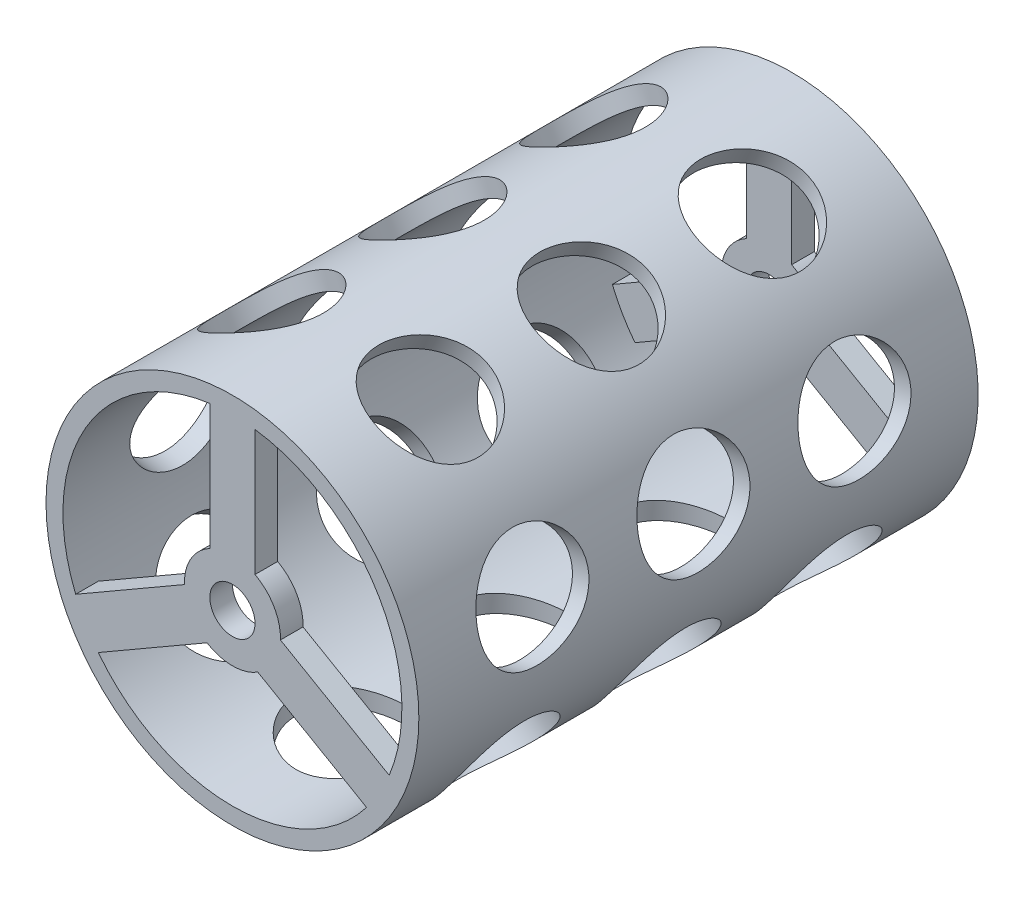
from build123d import *
from build123d.topology import SkipClean

# Parameters (mm, degrees)
IZIM1_R                     = 33
IZIM1_R_2                   = 30
Y_KSEKLIK_EKSTR_ZYON1_DEPTH = 95
Y_KSEKLIK_EKSTR_ZYON2_START = 4
IZIM2_R                     = 33
Y_KSEKLIK_EKSTR_ZYON2_DEPTH = 4
Y_KSEKLIK_EKSTR_ZYON3_START = -4
IZIM3_R                     = 33
Y_KSEKLIK_EKSTR_ZYON3_DEPTH = 4
KES_EKSTR_ZYON1_DEPTH       = 122
IZIM5_R                     = 4
KES_EKSTR_ZYON2_DEPTH       = 122
KES_EKSTR_ZYON3_START       = -75
IZIM6_R                     = 9.75
KES_EKSTR_ZYON3_DEPTH       = 81
DAIRESEL_KAPLAMA1_COUNT     = 7


with BuildPart() as part:
    # Çizim1 → Yükseklik-Ekstrüzyon1 (new body)
    with BuildSketch(Plane.XY):
        Circle(IZIM1_R)
        Circle(IZIM1_R_2, mode=Mode.SUBTRACT)
    extrude(amount=Y_KSEKLIK_EKSTR_ZYON1_DEPTH)

    # Çizim2 → Yükseklik-Ekstrüzyon2 (add)
    with BuildSketch(Plane(origin=(0, 0, 0), x_dir=(-1, 0, 0), z_dir=(0, 0, -1)).offset(Y_KSEKLIK_EKSTR_ZYON2_START)):
        Circle(IZIM2_R)
    extrude(amount=-Y_KSEKLIK_EKSTR_ZYON2_DEPTH)

    # Çizim3 → Yükseklik-Ekstrüzyon3 (add)
    with BuildSketch(Plane.XY.offset(95).offset(Y_KSEKLIK_EKSTR_ZYON3_START)):
        Circle(IZIM3_R)
    extrude(amount=Y_KSEKLIK_EKSTR_ZYON3_DEPTH)

    # Çizim4 → Kes-Ekstrüzyon1 (cut)
    with BuildSketch(Plane(origin=(0, 0, -4), x_dir=(-1, 0, 0), z_dir=(0, 0, -1))):
        with BuildLine():
            ThreePointArc((4, 7.5), (7.361215932, 4.25), (8.495190528, -0.285898385))
            Line((8.495190528, -0.285898385), (27.748786379, -11.401967132))
            ThreePointArc((27.748786379, -11.401967132), (25.980762114, 15), (4, 29.732137495))
            Line((4, 29.732137495), (4, 7.5))
        make_face()
        with BuildLine():
            Line((-4, 7.5), (-4, 29.732137495))
            ThreePointArc((-4, 29.732137495), (-25.980762114, 15), (-27.748786379, -11.401967132))
            Line((-27.748786379, -11.401967132), (-8.495190528, -0.285898385))
            ThreePointArc((-8.495190528, -0.285898385), (-7.361215932, 4.25), (-4, 7.5))
        make_face()
        with BuildLine():
            ThreePointArc((-23.748786379, -18.330170362), (0, -30), (23.748786379, -18.330170362))
            Line((23.748786379, -18.330170362), (4.495190528, -7.214101615))
            ThreePointArc((4.495190528, -7.214101615), (0, -8.5), (-4.495190528, -7.214101615))
            Line((-4.495190528, -7.214101615), (-23.748786379, -18.330170362))
        make_face()
    extrude(amount=-KES_EKSTR_ZYON1_DEPTH, mode=Mode.SUBTRACT)

    # Çizim5 → Kes-Ekstrüzyon2 (cut)
    with BuildSketch(Plane(origin=(0, 0, -4), x_dir=(-1, 0, 0), z_dir=(0, 0, -1))):
        Circle(IZIM5_R)
    extrude(amount=-KES_EKSTR_ZYON2_DEPTH, mode=Mode.SUBTRACT)

    # Çizim6 → Kes-Ekstrüzyon3 (cut)
    with SkipClean():  # the faces are left unmerged after this step: merging them gives an invalid solid
        with BuildSketch(Plane(origin=(0, 0, 0), x_dir=(1, 0, 0), z_dir=(0, 1, 0)).offset(KES_EKSTR_ZYON3_START)):
            with Locations((0, -17)):
                Circle(IZIM6_R)
            with Locations((0, -45.5)):
                Circle(IZIM6_R)
            with Locations((0, -74)):
                Circle(IZIM6_R)
        kes_ekstr_zyon3 = extrude(amount=KES_EKSTR_ZYON3_DEPTH, mode=Mode.SUBTRACT)

    # Dairesel Kaplama1: Kes-Ekstrüzyon3 ×7 about axis
    with SkipClean():  # the faces are left unmerged after this step: merging them gives an invalid solid
        dairesel_kaplama1_axis = Axis((0, 0, -4), (0, 0, -1))
        for i in range(1, DAIRESEL_KAPLAMA1_COUNT):
            add(kes_ekstr_zyon3.rotate(dairesel_kaplama1_axis, i * 360 / DAIRESEL_KAPLAMA1_COUNT), mode=Mode.SUBTRACT)


solid = part.part
